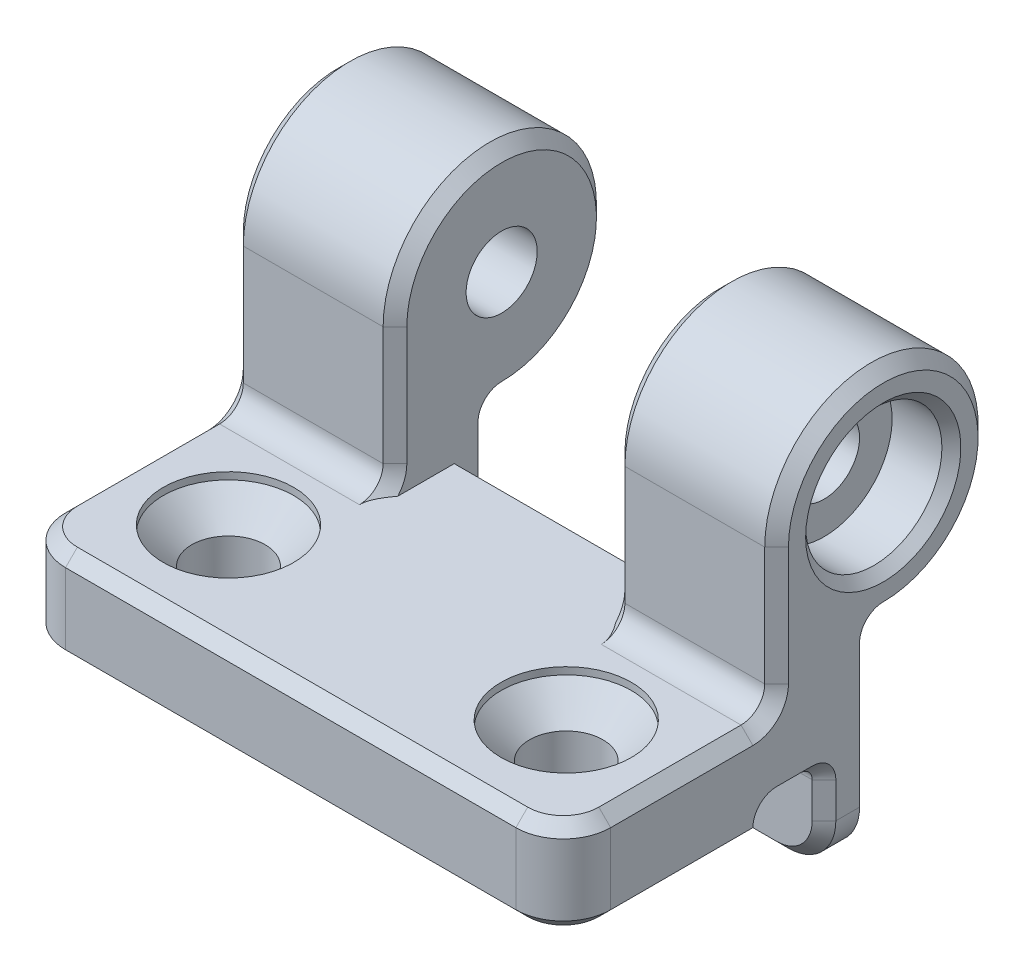
from build123d import *

# Parameters (mm, degrees)
SKETCH5_R           = 1.5
BOSS_EXTRUDE2_DEPTH = 11.5
SKETCH7_W           = 9.2
SKETCH7_H           = 11
CUT_EXTRUDE2_DEPTH  = 30.030156734
FILLET2_R           = 2
CUT_EXTRUDE9_DEPTH  = 9.2
FILLET3_R           = 0.5
CHAMFER2_SIZE       = 0.5
SKETCH11_R          = 1.5
CUT_EXTRUDE4_DEPTH  = 3.5
CUT_EXTRUDE5_DEPTH  = 1
CUT_EXTRUDE5_DRAFT  = -45
SKETCH12_R          = 2.875
CUT_EXTRUDE6_DEPTH  = 2.5
CHAMFER3_SIZE       = 0.4
SKETCH14_R          = 2.75
CUT_EXTRUDE7_DEPTH  = 0.3
CUT_EXTRUDE8_REACH  = 22.764
SKETCH15_R          = 1.55
CHAMFER4_SIZE       = 1.2


# Some blends are built 0.0001 mm under size
with BuildPart() as part:
    # Sketch5 → Boss-Extrude2 (new, symmetric)
    with BuildSketch(Plane(origin=(0, 0, 0), x_dir=(0, 0, -1), z_dir=(1, 0, 0))):
        with BuildLine():
            Line((-5, -10), (-5, -9))
            Line((-5, -9), (-2.5, -9))
            Line((-2.5, -9), (-2.5, -13))
            Line((-2.5, -13), (-0.5, -13))
            Line((-0.5, -13), (-0.5, -5))
            ThreePointArc((-0.5, -5), (-0.353553391, -4.646446609), (0, -4.5))
            ThreePointArc((0, -4.5), (3.181980515, 3.181980515), (-4.5, 0))
            Line((-4.5, 0), (-4.5, -5))
            ThreePointArc((-4.5, -5), (-4.792893219, -5.707106781), (-5.5, -6))
            Line((-5.5, -6), (-13.5, -6))
            Line((-13.5, -6), (-13.5, -10))
            Line((-13.5, -10), (-5, -10))
        make_face()
        Circle(SKETCH5_R, mode=Mode.SUBTRACT)
    extrude(amount=BOSS_EXTRUDE2_DEPTH, both=True)

    # Sketch7 → Cut-Extrude2 (cut, through all)
    with BuildSketch(Plane(origin=(0, -6, -11), x_dir=(-1, 0, 0), z_dir=(0, -1, 0))):
        with Locations((0, -12)):
            Rectangle(SKETCH7_W, SKETCH7_H)
    extrude(amount=-CUT_EXTRUDE2_DEPTH, mode=Mode.SUBTRACT)

    # Fillet2
    fillet2_edges = [part.edges().sort_by_distance(p)[0] for p in [
        (-11.5, -13, 1.5),
        (-11.5, -8, 13.5),
        (11.5, -8, 13.5),
        (11.5, -13, 1.5),
    ]]
    fillet(fillet2_edges, radius=FILLET2_R)

    # Sketch16 → Cut-Extrude9 (cut)
    with BuildSketch(Plane(origin=(-4.6, 0, 0), x_dir=(0, 0, -1), z_dir=(1, 0, 0))):
        Polygon((-2, -6), (-0.5, -6), (-0.5, -7.5), align=None)
    extrude(amount=CUT_EXTRUDE9_DEPTH, mode=Mode.SUBTRACT)

    # Fillet3
    fillet3_edges = [part.edges().sort_by_distance(p)[0] for p in [
        (0, -10, 5),
        (0, -9, 5),
        (0, -9, 2.5),
    ]]
    fillet(fillet3_edges, radius=FILLET3_R - 0.0001)  # a hair under: the kernel refuses the full size

    # Chamfer2
    # the kernel refuses this chamfer: 0.5 mm, written as the material it takes off along each edge
    with BuildSketch(Plane(origin=(11.5, 0, 4.5), x_dir=(0, 0, -1), z_dir=(0, -1, 0)), Plane(origin=(4.6, 0, 4.5), x_dir=(1, 0, 0), z_dir=(0, -1, 0)), Plane(origin=(-4.6, -5, 4.5), x_dir=(-1, 0, 0), z_dir=(0, 1, 0))) as chamfer2_piece_1:
        Polygon((CHAMFER2_SIZE, 0), (0, -CHAMFER2_SIZE), (0, 0), align=None)
    extrude(amount=5, mode=Mode.SUBTRACT)
    with BuildSketch(Plane(origin=(-11.5, -9.4999, 2.5), x_dir=(0, 0, -1), z_dir=(0, -1, 0))) as chamfer2_piece_2:
        Polygon((CHAMFER2_SIZE, 0), (0, CHAMFER2_SIZE), (0, 0), align=None)
    extrude(amount=1.5001, mode=Mode.SUBTRACT)
    with BuildSketch(Plane(origin=(-11.5, -9, 4.5001), x_dir=(0, 1, 0), z_dir=(0, 0, -1))) as chamfer2_piece_3:
        Polygon((CHAMFER2_SIZE, 0), (0, CHAMFER2_SIZE), (0, 0), align=None)
    extrude(amount=1.5002, mode=Mode.SUBTRACT)
    with BuildSketch(Plane(origin=(-11.5, -9.5001, 5.4999), x_dir=(0, -1, 0), z_dir=(0, 0, 1))) as chamfer2_piece_4:
        Polygon((0.4999 - CHAMFER2_SIZE * 0.9998, CHAMFER2_SIZE * 0.0002), (0.4999, CHAMFER2_SIZE), (0.4999, 0), (0.4999 - CHAMFER2_SIZE * 0.9998, 0), align=None)
    revolve(axis=Axis((-11.5, -9.5001, 5.4999), (1, 0, 0)), revolution_arc=90, mode=Mode.SUBTRACT)
    with BuildSketch(Plane(origin=(11.5, -9.4999, 2.5), x_dir=(0, 0, -1), z_dir=(0, -1, 0))) as chamfer2_piece_5:
        Polygon((CHAMFER2_SIZE, 0), (0, -CHAMFER2_SIZE), (0, 0), align=None)
    extrude(amount=1.5001, mode=Mode.SUBTRACT)
    with BuildSketch(Plane(origin=(11.5, -9, 4.5001), x_dir=(0, 1, 0), z_dir=(0, 0, -1))) as chamfer2_piece_6:
        Polygon((CHAMFER2_SIZE, 0), (0, -CHAMFER2_SIZE), (0, 0), align=None)
    extrude(amount=1.5002, mode=Mode.SUBTRACT)
    with BuildSketch(Plane(origin=(11.5, -9.5001, 5.4999), x_dir=(0, -1, 0), z_dir=(0, 0, 1))) as chamfer2_piece_7:
        Polygon((0.4999, -CHAMFER2_SIZE), (0.4999 - CHAMFER2_SIZE * 0.9998, -CHAMFER2_SIZE * 0.0002), (0.4999 - CHAMFER2_SIZE * 0.9998, 0), (0.4999, 0), align=None)
    revolve(axis=Axis((11.5, -9.5001, 5.4999), (1, 0, 0)), revolution_arc=90, mode=Mode.SUBTRACT)
    with BuildSketch(Plane(origin=(-11.5, -9.4999, 4.5001), x_dir=(0, 1, 0), z_dir=(0, 0, -1))) as chamfer2_piece_8:
        Polygon((0.4999 + CHAMFER2_SIZE, 0), (0.4999, CHAMFER2_SIZE), (0.4999, 0), align=None)
    revolve(axis=Axis((-11.5, -9.4999, 4.5001), (1, 0, 0)), revolution_arc=90, mode=Mode.SUBTRACT)
    with BuildSketch(Plane(origin=(11.5, -9.4999, 4.5001), x_dir=(0, 1, 0), z_dir=(0, 0, -1))) as chamfer2_piece_9:
        Polygon((0.4999 + CHAMFER2_SIZE, 0), (0.4999, -CHAMFER2_SIZE), (0.4999, 0), align=None)
    revolve(axis=Axis((11.5, -9.4999, 4.5001), (1, 0, 0)), revolution_arc=90, mode=Mode.SUBTRACT)
    with BuildSketch(Plane(origin=(-11.5, -9.4999, 2.9999), x_dir=(0, 0, -1), z_dir=(0, -1, 0))) as chamfer2_piece_10:
        Polygon((0.4999 + CHAMFER2_SIZE, 0), (0.4999, CHAMFER2_SIZE), (0.4999, 0), align=None)
    revolve(axis=Axis((-11.5, -9.4999, 2.9999), (1, 0, 0)), revolution_arc=90, mode=Mode.SUBTRACT)
    with BuildSketch(Plane(origin=(11.5, -9.4999, 2.9999), x_dir=(0, 0, -1), z_dir=(0, -1, 0))) as chamfer2_piece_11:
        Polygon((0.4999 + CHAMFER2_SIZE, 0), (0.4999, -CHAMFER2_SIZE), (0.4999, 0), align=None)
    revolve(axis=Axis((11.5, -9.4999, 2.9999), (1, 0, 0)), revolution_arc=90, mode=Mode.SUBTRACT)
    with BuildSketch(Plane(origin=(11.5, -5, 5.5), x_dir=(0, 0, -1), z_dir=(0, 1, 0))) as chamfer2_piece_12:
        Polygon((1 + CHAMFER2_SIZE, 0), (1, CHAMFER2_SIZE), (1, 0), align=None)
    revolve(axis=Axis((11.5, -5, 5.5), (-1, 0, 0)), revolution_arc=90, mode=Mode.SUBTRACT)
    with BuildSketch(Plane(origin=(-11.5, -6, 5.5), x_dir=(0, -1, 0), z_dir=(0, 0, 1)), Plane(origin=(-11.5, -11, 0.5), x_dir=(0, 0, 1), z_dir=(0, 1, 0))) as chamfer2_piece_13:
        Polygon((CHAMFER2_SIZE, 0), (0, CHAMFER2_SIZE), (0, 0), align=None)
    extrude(amount=6, mode=Mode.SUBTRACT)
    with BuildSketch(Plane(origin=(-11.5, -5, 5.5), x_dir=(0, 0, -1), z_dir=(0, 1, 0))) as chamfer2_piece_14:
        Polygon((1 + CHAMFER2_SIZE, 0), (1, -CHAMFER2_SIZE), (1, 0), align=None)
    revolve(axis=Axis((-11.5, -5, 5.5), (-1, 0, 0)), revolution_arc=90, mode=Mode.SUBTRACT)
    with BuildSketch(Plane(origin=(-11.5, 0, 4.5), x_dir=(0, 0, -1), z_dir=(0, -1, 0))) as chamfer2_piece_15:
        Polygon((CHAMFER2_SIZE, 0), (0, CHAMFER2_SIZE), (0, 0), align=None)
    extrude(amount=5, mode=Mode.SUBTRACT)
    with BuildSketch(Plane(origin=(-11.5, 0, 0), x_dir=(0, -1, 0), z_dir=(0, 0, 1))) as chamfer2_piece_16:
        Polygon((4.5 - CHAMFER2_SIZE, 0), (4.5, CHAMFER2_SIZE), (4.5, 0), align=None)
    revolve(axis=Axis((-11.5, 0, 0), (1, 0, 0)), revolution_arc=270, mode=Mode.SUBTRACT)
    with BuildSketch(Plane(origin=(-11.5, -5, 0), x_dir=(0, 0, 1), z_dir=(0, -1, 0))) as chamfer2_piece_17:
        Polygon((0.5 + CHAMFER2_SIZE, 0), (0.5, -CHAMFER2_SIZE), (0.5, 0), align=None)
    revolve(axis=Axis((-11.5, -5, 0), (-1, 0, 0)), revolution_arc=90, mode=Mode.SUBTRACT)
    with BuildSketch(Plane(origin=(11.5, -6, 5.5), x_dir=(0, -1, 0), z_dir=(0, 0, 1)), Plane(origin=(11.5, -11, 0.5), x_dir=(0, 0, 1), z_dir=(0, 1, 0))) as chamfer2_piece_18:
        Polygon((CHAMFER2_SIZE, 0), (0, -CHAMFER2_SIZE), (0, 0), align=None)
    extrude(amount=6, mode=Mode.SUBTRACT)
    with BuildSketch(Plane(origin=(11.5, -5, 0), x_dir=(0, 0, 1), z_dir=(0, -1, 0))) as chamfer2_piece_19:
        Polygon((0.5 + CHAMFER2_SIZE, 0), (0.5, CHAMFER2_SIZE), (0.5, 0), align=None)
    revolve(axis=Axis((11.5, -5, 0), (-1, 0, 0)), revolution_arc=90, mode=Mode.SUBTRACT)
    with BuildSketch(Plane(origin=(4.6, -5, 5.5), x_dir=(0, -0.2806183648257218, 0.9598194274562992), z_dir=(0, 0.9598194274562992, 0.2806183648257218))) as chamfer2_piece_20_section:
        Polygon((1, CHAMFER2_SIZE), (1 + CHAMFER2_SIZE, 0), (1, 0), align=None)
    chamfer2_piece_20 = revolve(axis=Axis((4.6, -5, 5.5), (1, 0, 0)), revolution_arc=163.70288589, mode=Mode.PRIVATE)
    chamfer2_piece_20 = split(chamfer2_piece_20, bisect_by=Plane(origin=(4.6, -6, 5.5), z_dir=(0, 1, 0)), keep=Keep.TOP, mode=Mode.PRIVATE)
    add(chamfer2_piece_20, mode=Mode.SUBTRACT)
    with BuildSketch(Plane(origin=(4.6, -8.785841494, 0.5), x_dir=(1, 0, 0), z_dir=(0, 1, 0))) as chamfer2_piece_21_section:
        Polygon((CHAMFER2_SIZE, 0), (0, -CHAMFER2_SIZE), (0, 0), align=None)
    chamfer2_piece_21 = extrude(amount=3.785841494, mode=Mode.PRIVATE)
    chamfer2_piece_21 = split(chamfer2_piece_21, bisect_by=Plane(origin=(4.6, -8.142920747, -0.142920747), z_dir=(0, 0.7071067811865475, -0.7071067811865476)), keep=Keep.TOP, mode=Mode.PRIVATE)
    add(chamfer2_piece_21, mode=Mode.SUBTRACT)
    with BuildSketch(Plane(origin=(4.6, -5, 0), x_dir=(0, 1, 0), z_dir=(0, 0, -1))) as chamfer2_piece_22:
        Polygon((0.5, CHAMFER2_SIZE), (0.5 + CHAMFER2_SIZE, 0), (0.5, 0), align=None)
    revolve(axis=Axis((4.6, -5, 0), (1, 0, 0)), revolution_arc=90, mode=Mode.SUBTRACT)
    with BuildSketch(Plane(origin=(4.6, 0, 0), x_dir=(0, -1, 0), z_dir=(0, 0, 1))) as chamfer2_piece_23:
        Polygon((4.5, CHAMFER2_SIZE), (4.5 - CHAMFER2_SIZE, 0), (4.5, 0), align=None)
    revolve(axis=Axis((4.6, 0, 0), (1, 0, 0)), revolution_arc=270, mode=Mode.SUBTRACT)
    with BuildSketch(Plane(origin=(-4.6, -5, 5.5), x_dir=(0, -0.2806183648257218, 0.9598194274562992), z_dir=(0, 0.9598194274562992, 0.2806183648257218))) as chamfer2_piece_24_section:
        Polygon((1, -CHAMFER2_SIZE), (1 + CHAMFER2_SIZE, 0), (1, 0), align=None)
    chamfer2_piece_24 = revolve(axis=Axis((-4.6, -5, 5.5), (1, 0, 0)), revolution_arc=163.70288589, mode=Mode.PRIVATE)
    chamfer2_piece_24 = split(chamfer2_piece_24, bisect_by=Plane(origin=(-4.6, -6, 5.5), z_dir=(0, 1, 0)), keep=Keep.TOP, mode=Mode.PRIVATE)
    add(chamfer2_piece_24, mode=Mode.SUBTRACT)
    with BuildSketch(Plane(origin=(-4.6, 0, 0), x_dir=(0, 0, 1), z_dir=(0, -1, 0))) as chamfer2_piece_25:
        Polygon((4.5, CHAMFER2_SIZE), (4.5 - CHAMFER2_SIZE, 0), (4.5, 0), align=None)
    revolve(axis=Axis((-4.6, 0, 0), (-1, 0, 0)), revolution_arc=270, mode=Mode.SUBTRACT)
    with BuildSketch(Plane(origin=(-4.6, -5, 0), x_dir=(0, 1, 0), z_dir=(0, 0, -1))) as chamfer2_piece_26:
        Polygon((0.5, -CHAMFER2_SIZE), (0.5 + CHAMFER2_SIZE, 0), (0.5, 0), align=None)
    revolve(axis=Axis((-4.6, -5, 0), (1, 0, 0)), revolution_arc=90, mode=Mode.SUBTRACT)
    with BuildSketch(Plane(origin=(-4.6, -5, 0.5), x_dir=(-1, 0, 0), z_dir=(0, -1, 0))) as chamfer2_piece_27_section:
        Polygon((CHAMFER2_SIZE, 0), (0, -CHAMFER2_SIZE), (0, 0), align=None)
    chamfer2_piece_27 = extrude(amount=3.785841494, mode=Mode.PRIVATE)
    chamfer2_piece_27 = split(chamfer2_piece_27, bisect_by=Plane(origin=(-4.6, -6.25, 1.75), z_dir=(0, 0.7071067811865475, -0.7071067811865476)), keep=Keep.TOP, mode=Mode.PRIVATE)
    add(chamfer2_piece_27, mode=Mode.SUBTRACT)
    with BuildSketch(Plane(origin=(11.5, 0, 0), x_dir=(0, -1, 0), z_dir=(0, 0, 1))) as chamfer2_piece_28:
        Polygon((4.5 - CHAMFER2_SIZE, 0), (4.5, -CHAMFER2_SIZE), (4.5, 0), align=None)
    revolve(axis=Axis((11.5, 0, 0), (1, 0, 0)), revolution_arc=270, mode=Mode.SUBTRACT)
    with BuildSketch(Plane(origin=(11.5, -10, 11.5), x_dir=(-1, 0, 0), z_dir=(0, 0, -1))) as chamfer2_piece_29:
        Polygon((CHAMFER2_SIZE, 0), (0, CHAMFER2_SIZE), (0, 0), align=None)
    extrude(amount=6.0001, mode=Mode.SUBTRACT)
    with BuildSketch(Plane(origin=(-9.5, -13, 0.5), x_dir=(0, 1, 0), z_dir=(1, 0, 0))) as chamfer2_piece_30:
        Polygon((CHAMFER2_SIZE, 0), (0, CHAMFER2_SIZE), (0, 0), align=None)
    extrude(amount=19, mode=Mode.SUBTRACT)
    with BuildSketch(Plane(origin=(-9.5, -11, 0.5), x_dir=(0, -1, 0), z_dir=(1, 0, 0))) as chamfer2_piece_31:
        Polygon((2, -CHAMFER2_SIZE), (2 - CHAMFER2_SIZE, 0), (2, 0), align=None)
    revolve(axis=Axis((-9.5, -11, 0.5), (0, 0, -1)), revolution_arc=90, mode=Mode.SUBTRACT)
    with BuildSketch(Plane(origin=(9.5, -11, 0.5), x_dir=(0, -1, 0), z_dir=(-1, 0, 0))) as chamfer2_piece_32:
        Polygon((2 - CHAMFER2_SIZE, 0), (2, CHAMFER2_SIZE), (2, 0), align=None)
    revolve(axis=Axis((9.5, -11, 0.5), (0, 0, 1)), revolution_arc=90, mode=Mode.SUBTRACT)
    with BuildSketch(Plane(origin=(-9.5, -13, 2.5), x_dir=(0, 1, 0), z_dir=(1, 0, 0)), Plane(origin=(9.5, -10, 13.5), x_dir=(0, 0, -1), z_dir=(-1, 0, 0)), Plane(origin=(9.5, -6, 13.5), x_dir=(0, -1, 0), z_dir=(-1, 0, 0))) as chamfer2_piece_33:
        Polygon((CHAMFER2_SIZE, 0), (0, -CHAMFER2_SIZE), (0, 0), align=None)
    extrude(amount=19, mode=Mode.SUBTRACT)
    with BuildSketch(Plane(origin=(-9.5, -11, 2.5), x_dir=(0, -1, 0), z_dir=(1, 0, 0))) as chamfer2_piece_34:
        Polygon((2 - CHAMFER2_SIZE, 0), (2, CHAMFER2_SIZE), (2, 0), align=None)
    revolve(axis=Axis((-9.5, -11, 2.5), (0, 0, -1)), revolution_arc=90, mode=Mode.SUBTRACT)
    with BuildSketch(Plane(origin=(9.5, -11, 2.5), x_dir=(0, -1, 0), z_dir=(-1, 0, 0))) as chamfer2_piece_35:
        Polygon((2 - CHAMFER2_SIZE, 0), (2, -CHAMFER2_SIZE), (2, 0), align=None)
    revolve(axis=Axis((9.5, -11, 2.5), (0, 0, 1)), revolution_arc=90, mode=Mode.SUBTRACT)
    with BuildSketch(Plane(origin=(-11.5, -10, 11.5), x_dir=(1, 0, 0), z_dir=(0, 0, -1))) as chamfer2_piece_36:
        Polygon((CHAMFER2_SIZE, 0), (0, -CHAMFER2_SIZE), (0, 0), align=None)
    extrude(amount=6.0001, mode=Mode.SUBTRACT)
    with BuildSketch(Plane(origin=(9.5, -10, 11.5), x_dir=(0, 0, 1), z_dir=(-1, 0, 0))) as chamfer2_piece_37:
        Polygon((2 - CHAMFER2_SIZE, 0), (2, CHAMFER2_SIZE), (2, 0), align=None)
    revolve(axis=Axis((9.5, -10, 11.5), (0, 1, 0)), revolution_arc=90, mode=Mode.SUBTRACT)
    with BuildSketch(Plane(origin=(-9.5, -10, 11.5), x_dir=(0, 0, 1), z_dir=(1, 0, 0))) as chamfer2_piece_38:
        Polygon((2 - CHAMFER2_SIZE, 0), (2, -CHAMFER2_SIZE), (2, 0), align=None)
    revolve(axis=Axis((-9.5, -10, 11.5), (0, -1, 0)), revolution_arc=90, mode=Mode.SUBTRACT)
    with BuildSketch(Plane(origin=(9.5, -6, 11.5), x_dir=(0, 0, 1), z_dir=(-1, 0, 0))) as chamfer2_piece_39:
        Polygon((2, -CHAMFER2_SIZE), (2 - CHAMFER2_SIZE, 0), (2, 0), align=None)
    revolve(axis=Axis((9.5, -6, 11.5), (0, 1, 0)), revolution_arc=90, mode=Mode.SUBTRACT)
    with BuildSketch(Plane(origin=(-9.5, -6, 11.5), x_dir=(0, 0, 1), z_dir=(1, 0, 0))) as chamfer2_piece_40:
        Polygon((2, CHAMFER2_SIZE), (2 - CHAMFER2_SIZE, 0), (2, 0), align=None)
    revolve(axis=Axis((-9.5, -6, 11.5), (0, -1, 0)), revolution_arc=90, mode=Mode.SUBTRACT)
    with BuildSketch(Plane(origin=(11.5, -9.5001, 5), x_dir=(0, 0, 1), z_dir=(0, 1, 0))) as chamfer2_piece_41:
        Polygon((CHAMFER2_SIZE, 0), (0, -CHAMFER2_SIZE), (0, 0), align=None)
    extrude(amount=0.0002, mode=Mode.SUBTRACT)
    with BuildSketch(Plane(origin=(-11.5, -9.5001, 5), x_dir=(0, 0, 1), z_dir=(0, 1, 0))) as chamfer2_piece_42:
        Polygon((CHAMFER2_SIZE, 0), (0, CHAMFER2_SIZE), (0, 0), align=None)
    extrude(amount=0.0002, mode=Mode.SUBTRACT)

    # Sketch11 → Cut-Extrude4 (cut)
    with BuildSketch(Plane.ZY.offset(11.5)):
        Polygon((-3.175426481, 0), (-1.58771324, 2.75), (1.58771324, 2.75), (3.175426481, 0), (1.58771324, -2.75), (-1.58771324, -2.75), align=None)
        Circle(SKETCH11_R, mode=Mode.SUBTRACT)
    extrude(amount=-CUT_EXTRUDE4_DEPTH, mode=Mode.SUBTRACT)


with BuildPart() as cut_extrude5_tool:
    # Sketch11<3> → Cut-Extrude5 (with draft: the straight prism first)
    with BuildSketch(Plane.ZY.offset(11.5)):
        with BuildLine():
            ThreePointArc((-0.503118376, 3.135315811), (-1.635062987, 2.832012166), (-2.463703953, 2.0033712))
            Line((-2.463703953, 2.0033712), (-2.966822329, 1.131944611))
            ThreePointArc((-2.966822329, 1.131944611), (-3.270125973, 0), (-2.966822329, -1.131944611))
            Line((-2.966822329, -1.131944611), (-2.463703953, -2.0033712))
            ThreePointArc((-2.463703953, -2.0033712), (-1.635062987, -2.832012166), (-0.503118376, -3.135315811))
            Line((-0.503118376, -3.135315811), (0.503118376, -3.135315811))
            ThreePointArc((0.503118376, -3.135315811), (1.635062987, -2.832012166), (2.463703953, -2.0033712))
            Line((2.463703953, -2.0033712), (2.966822329, -1.131944611))
            ThreePointArc((2.966822329, -1.131944611), (3.270125973, 0), (2.966822329, 1.131944611))
            Line((2.966822329, 1.131944611), (2.463703953, 2.0033712))
            ThreePointArc((2.463703953, 2.0033712), (1.635062987, 2.832012166), (0.503118376, 3.135315811))
            Line((0.503118376, 3.135315811), (-0.503118376, 3.135315811))
        make_face()
    extrude(amount=-CUT_EXTRUDE5_DEPTH)
    # Cut-Extrude5: the draft: its side faces are tilted about the plane it starts from
    cut_extrude5_sides = [cut_extrude5_tool.faces().sort_by_distance(p)[0] for p in [
        (-11, 2.832012166, -1.635062987),
        (-11, 1.567657905, -2.715263141),
        (-11, 0, -3.270125973),
        (-11, -1.567657905, -2.715263141),
        (-11, -2.832012166, -1.635062987),
        (-11, -3.135315811, 0),
        (-11, -2.832012166, 1.635062987),
        (-11, -1.567657905, 2.715263141),
        (-11, 0, 3.270125973),
        (-11, 1.567657905, 2.715263141),
        (-11, 2.832012166, 1.635062987),
        (-11, 3.135315811, 0),
    ]]
    draft(cut_extrude5_sides, Plane.ZY.offset(11.5), CUT_EXTRUDE5_DRAFT)


with BuildPart() as part_1:
    add(part.part)

    # Cut-Extrude5: cut by cut_extrude5_tool
    add(cut_extrude5_tool.part, mode=Mode.SUBTRACT)

    # Sketch12 → Cut-Extrude6 (cut)
    with BuildSketch(Plane(origin=(11.5, 0, 0), x_dir=(0, 0, -1), z_dir=(1, 0, 0))):
        Circle(SKETCH12_R)
    extrude(amount=-CUT_EXTRUDE6_DEPTH, mode=Mode.SUBTRACT)

    # Chamfer3
    chamfer3_edges = [part_1.edges().sort_by_distance(p)[0] for p in [
        (11.5, 0, 2.875),
    ]]
    chamfer(chamfer3_edges, length=CHAMFER3_SIZE)

    # Sketch14 → Cut-Extrude7 (cut)
    with BuildSketch(Plane(origin=(0, -6, 0), x_dir=(1, 0, 0), z_dir=(0, 1, 0))):
        with Locations(Location((7.125, -9, 0), (0, 0, 270))):
            Circle(SKETCH14_R)
        with Locations(Location((-7.125, -9, 0), (0, 0, 90))):
            Circle(SKETCH14_R)
    extrude(amount=-CUT_EXTRUDE7_DEPTH, mode=Mode.SUBTRACT)

    # Sketch15 → Cut-Extrude8 (cut, up to next)
    with BuildSketch(Plane(origin=(0, -6.3, 0), x_dir=(1, 0, 0), z_dir=(0, 1, 0)), mode=Mode.PRIVATE) as cut_extrude8_sk1:
        with Locations(Location((7.125, -9, 0), (0, 0, 270))):
            Circle(SKETCH15_R)
    cut_extrude8_tool1 = extrude(cut_extrude8_sk1.sketch, amount=-CUT_EXTRUDE8_REACH, mode=Mode.PRIVATE) & part_1.part
    # Sketch15 → Cut-Extrude8 (cut, up to next)
    with BuildSketch(Plane(origin=(0, -6.3, 0), x_dir=(1, 0, 0), z_dir=(0, 1, 0)), mode=Mode.PRIVATE) as cut_extrude8_sk2:
        with Locations(Location((-7.125, -9, 0), (0, 0, 270))):
            Circle(SKETCH15_R)
    cut_extrude8_tool2 = extrude(cut_extrude8_sk2.sketch, amount=-CUT_EXTRUDE8_REACH, mode=Mode.PRIVATE) & part_1.part
    add(cut_extrude8_tool1.solids().sort_by_distance((7.125, -6.3, 9))[0], mode=Mode.SUBTRACT)
    add(cut_extrude8_tool2.solids().sort_by_distance((-7.125, -6.3, 9))[0], mode=Mode.SUBTRACT)

    # Chamfer4
    chamfer4_edges = [part_1.edges().sort_by_distance(p)[0] for p in [
        (7.125, -6.3, 7.45),
        (-7.125, -6.3, 7.45),
    ]]
    chamfer(chamfer4_edges, length=CHAMFER4_SIZE - 0.0001)  # a hair under: the kernel refuses the full size


solid = part_1.part
